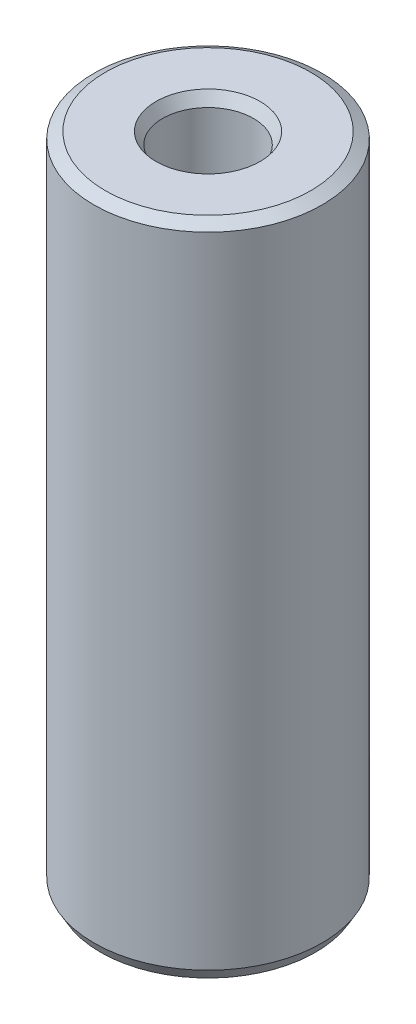
from build123d import *
from OCP.BRepFilletAPI import BRepFilletAPI_MakeChamfer

# Parameters (mm, degrees)
SKETCH1_R           = 7.5
BOSS_EXTRUDE1_DEPTH = 43.200682825
SKETCH2_R           = 2.989583981
CUT_EXTRUDE1_DEPTH  = 45.483693603
CHAMFER1_SIZE       = 0.433373343
CHAMFER1_SIZE2      = 0.750624648


with BuildPart() as part:
    # Sketch1 → Boss-Extrude1 (new body)
    with BuildSketch(Plane(origin=(0, 0, 0), x_dir=(1, 0, 0), z_dir=(0, 1, 0))):
        Circle(SKETCH1_R)
    extrude(amount=BOSS_EXTRUDE1_DEPTH)

    # Sketch2 → Cut-Extrude1 (cut, through all)
    with BuildSketch(Plane(origin=(0, 0, 0), x_dir=(1, 0, 0), z_dir=(0, 1, 0))):
        Circle(SKETCH2_R)
    extrude(amount=CUT_EXTRUDE1_DEPTH, mode=Mode.SUBTRACT)

    # Chamfer1: one chamfer whose edges measure the first distance from different faces: ONE call of the kernel's chamfer builder (chamfer() names one face for all edges)
    chamfer1_edges_1 = [part.edges().sort_by_distance(p)[0] for p in [
        (-2.989583981, 43.200682825, 0),
    ]]
    chamfer1_side_1 = [part.faces().sort_by_distance(p)[0] for p in [
        (-7.287867966, 43.200682825, 0),
    ]]
    chamfer1_edges_2 = [part.edges().sort_by_distance(p)[0] for p in [
        (-2.989583981, 0, 0),
    ]]
    chamfer1_side_2 = [part.faces().sort_by_distance(p)[0] for p in [
        (-2.989583981, 21.600341413, 0),
    ]]
    chamfer1_edges_3 = [part.edges().sort_by_distance(p)[0] for p in [
        (-7.5, 0, 0),
    ]]
    chamfer1_side_3 = [part.faces().sort_by_distance(p)[0] for p in [
        (-7.287867966, 0, 0),
    ]]
    chamfer1_edges_4 = [part.edges().sort_by_distance(p)[0] for p in [
        (-7.5, 43.200682825, 0),
    ]]
    chamfer1_side_4 = [part.faces().sort_by_distance(p)[0] for p in [
        (-7.5, 21.600341413, 0),
    ]]
    chamfer1 = BRepFilletAPI_MakeChamfer(part.part.solid().wrapped)
    for e in chamfer1_edges_1:
        chamfer1.Add(CHAMFER1_SIZE, CHAMFER1_SIZE2, e.wrapped, chamfer1_side_1[0].wrapped)  # the first distance lies on this face
    for e in chamfer1_edges_2:
        chamfer1.Add(CHAMFER1_SIZE, CHAMFER1_SIZE2, e.wrapped, chamfer1_side_2[0].wrapped)  # the first distance lies on this face
    for e in chamfer1_edges_3:
        chamfer1.Add(CHAMFER1_SIZE, CHAMFER1_SIZE2, e.wrapped, chamfer1_side_3[0].wrapped)  # the first distance lies on this face
    for e in chamfer1_edges_4:
        chamfer1.Add(CHAMFER1_SIZE, CHAMFER1_SIZE2, e.wrapped, chamfer1_side_4[0].wrapped)  # the first distance lies on this face
    add(Compound.cast(chamfer1.Shape()), mode=Mode.REPLACE)


solid = part.part
